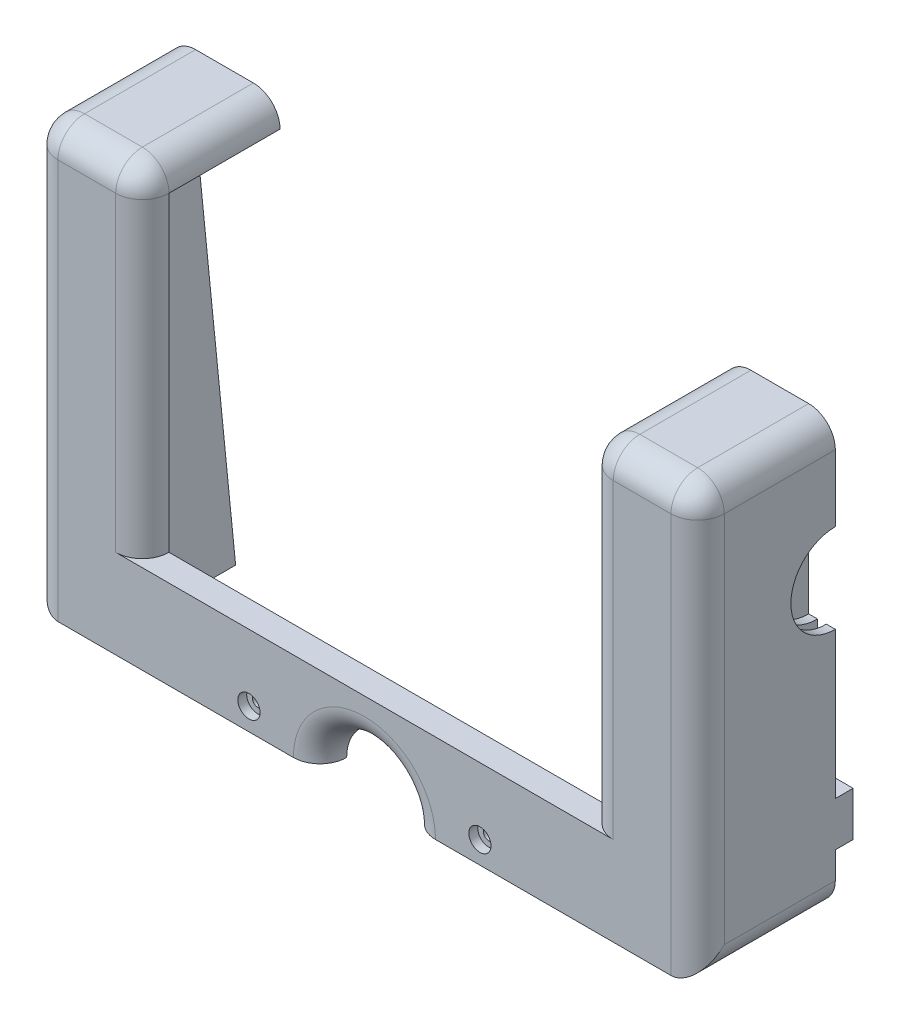
from build123d import *

# Parameters (mm, degrees)
SKETCH2_W           = 75
SKETCH2_H           = 48
BOSS_EXTRUDE1_DEPTH = 7.75
CUT_EXTRUDE4_DEPTH  = 12.5
SKETCH12_W          = 50
SKETCH12_H          = 38
CUT_EXTRUDE5_DEPTH  = 7.75
SKETCH13_R          = 0.625
CUT_EXTRUDE6_DEPTH  = 47.006113724
FILLET4_R           = 3
SKETCH14_W          = 2
SKETCH14_H          = 5
BOSS_EXTRUDE2_DEPTH = 2
SKETCH16_R          = 1.25
CUT_EXTRUDE9_DEPTH  = 1
SKETCH18_R          = 5
CUT_EXTRUDE10_DEPTH = 3
SKETCH19_R          = 7.5
CUT_EXTRUDE11_DEPTH = 0.5


with BuildPart() as part:
    # Sketch2 → Boss-Extrude1 (new, symmetric)
    with BuildSketch(Plane.XY):
        with Locations((0, 1.5)):
            Rectangle(SKETCH2_W, SKETCH2_H)
    extrude(amount=BOSS_EXTRUDE1_DEPTH, both=True)

    # Sketch11 → Cut-Extrude4 (cut)
    with BuildSketch(Plane(origin=(0, 0, -7.75), x_dir=(-1, 0, 0), z_dir=(0, 0, -1))):
        Polygon((-35, 22.5), (35, 22.5), (30, -22.5), (-30, -22.5), align=None)
    extrude(amount=-CUT_EXTRUDE4_DEPTH, mode=Mode.SUBTRACT)

    # Sketch12 → Cut-Extrude5 (cut, symmetric)
    with BuildSketch(Plane.XY):
        with Locations((0, 6.5)):
            Rectangle(SKETCH12_W, SKETCH12_H)
    extrude(amount=CUT_EXTRUDE5_DEPTH, both=True, mode=Mode.SUBTRACT)

    # Sketch13 → Cut-Extrude6 (cut, through all)
    with BuildSketch(Plane.XY):
        with Locations(Location((13, -20, 0), (0, 0, 180))):
            Circle(SKETCH13_R)
        with Locations(Location((-13, -20, 0), (0, 0, 180))):
            Circle(SKETCH13_R)
        with BuildLine():
            Line((-5, -22.5), (5, -22.5))
            ThreePointArc((5, -22.5), (0, -17.5), (-5, -22.5))
        make_face()
    extrude(amount=CUT_EXTRUDE6_DEPTH, mode=Mode.SUBTRACT)

    # Fillet4
    fillet4_edges = [part.edges().sort_by_distance(p)[0] for p in [
        (0, -17.5, 7.75),
        (37.5, 1.5, 7.75),
        (25, 6.5, 7.75),
        (-25, 6.5, 7.75),
        (-37.5, 1.5, 7.75),
        (25, 25.5, 0),
        (-25, 25.5, 0),
        (-37.5, 25.5, 0),
        (37.5, 25.5, 0),
        (31.25, 25.5, 7.75),
        (-31.25, 25.5, 7.75),
        (-37.5, -22.5, 0),
        (37.5, -22.5, 0),
    ]]
    fillet(fillet4_edges, radius=FILLET4_R - 0.0001)  # a hair under: the kernel refuses the full size

    # Sketch14 → Boss-Extrude2 (add)
    with BuildSketch(Plane(origin=(0, 0, -7.75), x_dir=(-1, 0, 0), z_dir=(0, 0, -1))):
        with Locations((-36.5, -14)):
            Rectangle(SKETCH14_W, SKETCH14_H)
        with Locations((36.5, -14)):
            Rectangle(SKETCH14_W, SKETCH14_H)
    extrude(amount=BOSS_EXTRUDE2_DEPTH)

    # Sketch16 → Cut-Extrude9 (cut)
    with BuildSketch(Plane.XY.offset(7.75)):
        with Locations((-13, -20)):
            Circle(SKETCH16_R)
        with Locations(Location((13, -20, 0), (0, 0, 180))):
            Circle(SKETCH16_R)
    extrude(amount=-CUT_EXTRUDE9_DEPTH, mode=Mode.SUBTRACT)

    # Sketch18 → Cut-Extrude10 (cut)
    with BuildSketch(Plane(origin=(37.5, 0, 0), x_dir=(0, 0, -1), z_dir=(1, 0, 0))):
        with Locations((7.75, 10)):
            Circle(SKETCH18_R)
    cut_extrude10 = extrude(amount=-CUT_EXTRUDE10_DEPTH, mode=Mode.SUBTRACT)

    # Sketch19 → Cut-Extrude11 (cut, symmetric)
    with BuildSketch(Plane(origin=(36, 0, 0), x_dir=(0, 0, -1), z_dir=(1, 0, 0))):
        with Locations((7.75, 10)):
            Circle(SKETCH19_R)
    cut_extrude11 = extrude(amount=CUT_EXTRUDE11_DEPTH, both=True, mode=Mode.SUBTRACT)

    # Mirror1: Cut-Extrude10, Cut-Extrude11 across plane
    add(cut_extrude10.mirror(Plane(origin=(0, 0, 0), x_dir=(0, 0, 1), z_dir=(1, 0, 0))), mode=Mode.SUBTRACT)
    add(cut_extrude11.mirror(Plane(origin=(0, 0, 0), x_dir=(0, 0, 1), z_dir=(1, 0, 0))), mode=Mode.SUBTRACT)


solid = part.part
